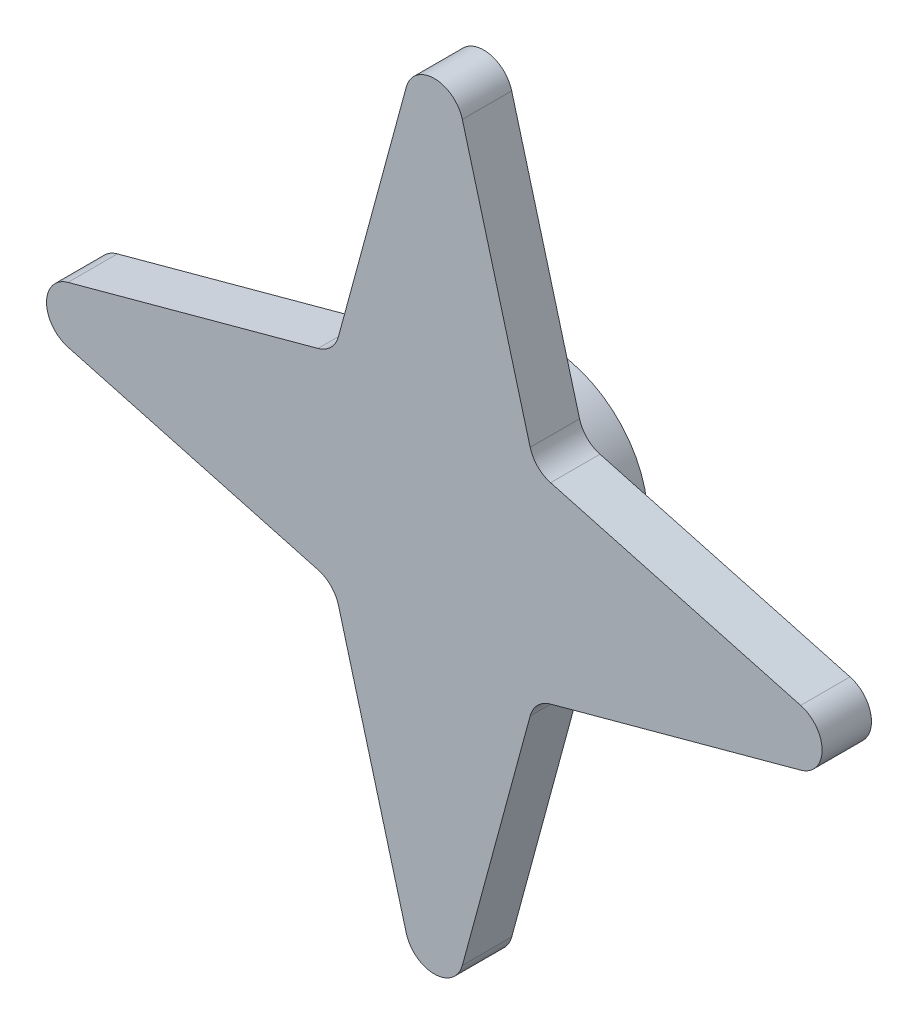
from build123d import *

# Parameters (mm, degrees)
SKETCH1_R            = 2.5
BOSS_EXTRUDE1_DEPTH  = 2.2
BOSS_EXTRUDE4_START  = 1.7
SKETCH1_9_R          = 3.45
BOSS_EXTRUDE4_DEPTH  = 1.7
BOSS_EXTRUDE5_START  = 1.7
BOSS_EXTRUDE5_DEPTH  = 1.7
MIRROR3_START        = 1.7
MIRROR3_COPY_1_DEPTH = 1.7
FILLET1_R            = 1


with BuildPart() as part:
    # Sketch1 → Boss-Extrude1 (new body)
    with BuildSketch(Plane.XY):
        with BuildLine():
            ThreePointArc((-1.7, 0), (-3.829742158, 3.187384387), (-7.589518395, 2.439518395))
            ThreePointArc((-7.589518395, 2.439518395), (-8.6, 0), (-7.589518395, -2.439518395))
            ThreePointArc((-7.589518395, -2.439518395), (-3.829742158, -3.187384387), (-1.7, 0))
        make_face()
        with Locations((-5.15, 0)):
            Circle(SKETCH1_R, mode=Mode.SUBTRACT)
    extrude(amount=-BOSS_EXTRUDE1_DEPTH)

    # Sketch1<9> → Boss-Extrude4 (add)
    with BuildSketch(Plane.XY.offset(BOSS_EXTRUDE4_START)):
        with Locations((-5.15, 0)):
            Circle(SKETCH1_9_R)
    extrude(amount=-BOSS_EXTRUDE4_DEPTH)

    # Sketch1<10> → Boss-Extrude5 (add)
    with BuildSketch(Plane.XY.offset(BOSS_EXTRUDE5_START)):
        with BuildLine():
            Line((-7.589518395, 2.439518395), (-8.6, 3.45))
            Line((-8.6, 3.45), (-17.761764559, 0.965131761))
            ThreePointArc((-17.761764559, 0.965131761), (-18.5, 0), (-17.761764559, -0.965131761))
            Line((-17.761764559, -0.965131761), (-8.6, -3.45))
            Line((-8.6, -3.45), (-7.589518395, -2.439518395))
            ThreePointArc((-7.589518395, -2.439518395), (-8.6, 0), (-7.589518395, 2.439518395))
        make_face()
    boss_extrude5 = extrude(amount=-BOSS_EXTRUDE5_DEPTH)

    # Mirror2: Boss-Extrude5 across plane
    add(boss_extrude5.mirror(Plane(origin=(-2.575, 2.575, 0), x_dir=(0, 0, 1), z_dir=(0.7071067811865476, -0.7071067811865475, 0))))

    # Mirror3: Boss-Extrude5 across plane
    add(boss_extrude5.mirror(Plane(origin=(-2.575, -2.575, 0), x_dir=(0, 0, 1), z_dir=(0.7071067811865476, 0.7071067811865475, 0))))

    # Mirror3 copy 1 sketch → Mirror3 copy 1 (add)
    with BuildSketch(Plane(origin=(-10.3, 0, 0), x_dir=(-1, 0, 0), z_dir=(0, 0, 1)).offset(MIRROR3_START)):
        with BuildLine():
            Line((-7.589518395, 2.439518395), (-8.6, 3.45))
            Line((-8.6, 3.45), (-17.761764559, 0.965131761))
            ThreePointArc((-17.761764559, 0.965131761), (-18.5, 0), (-17.761764559, -0.965131761))
            Line((-17.761764559, -0.965131761), (-8.6, -3.45))
            Line((-8.6, -3.45), (-7.589518395, -2.439518395))
            ThreePointArc((-7.589518395, -2.439518395), (-8.6, 0), (-7.589518395, 2.439518395))
        make_face()
    extrude(amount=-MIRROR3_COPY_1_DEPTH)

    # Fillet1
    fillet1_edges = [part.edges().sort_by_distance(p)[0] for p in [
        (-8.6, -3.45, 0.85),
        (-8.6, 3.45, 0.85),
        (-1.7, 3.45, 0.85),
        (-1.7, -3.45, 0.85),
    ]]
    fillet(fillet1_edges, radius=FILLET1_R)


solid = part.part
